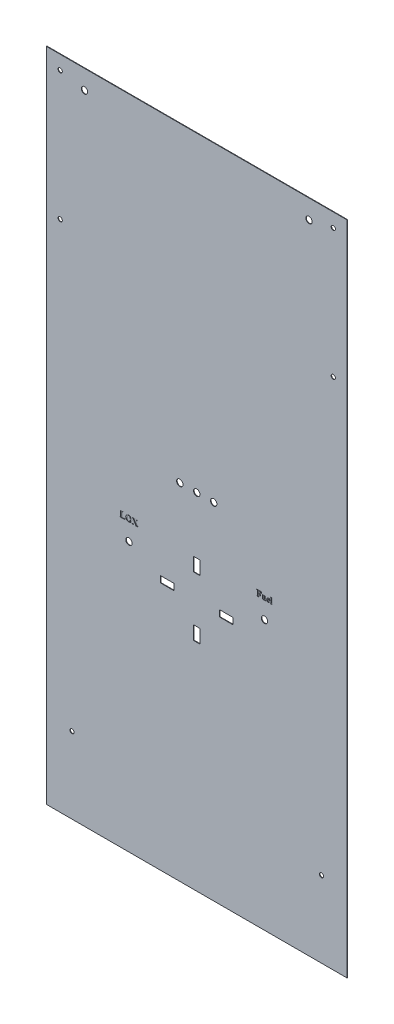
from build123d import *

# Parameters (mm, degrees)
SKETCH1_W           = 901.7
SKETCH1_H           = 1968.5
SKETCH1_R           = 6.35
BOSS_EXTRUDE1_DEPTH = 1.5875
SKETCH2_R           = 9.525
SKETCH2_W           = 19.05
SKETCH2_H           = 40.64
SKETCH2_W_2         = 40.64
SKETCH2_H_2         = 19.05
CUT_EXTRUDE1_DEPTH  = 1083.597018819
WRAP1_START         = -3.81
WRAP1_DEPTH         = 1.27
SKETCH4_R           = 9.525
CUT_EXTRUDE4_DEPTH  = 22.86
SKETCH6_R           = 9.525
CUT_EXTRUDE5_DEPTH  = 2.54


# Read off the part's stored shape, not the designer's step: Wrap1
with BuildPart() as part:
    # Sketch1 → Boss-Extrude1 (new body)
    with BuildSketch(Plane.XY):
        Rectangle(SKETCH1_W, SKETCH1_H)
        with Locations((-409.447415534, 942.65240495)):
            Circle(SKETCH1_R, mode=Mode.SUBTRACT)
        with Locations((-409.447415534, 555.94759505)):
            Circle(SKETCH1_R, mode=Mode.SUBTRACT)
        with Locations((-374.018387972, -755.65)):
            Circle(SKETCH1_R, mode=Mode.SUBTRACT)
        with Locations(Location((374.018387972, -755.65, 0), (0, 0, 180))):
            Circle(SKETCH1_R, mode=Mode.SUBTRACT)
        with Locations(Location((409.447415534, 555.94759505, 0), (0, 0, 180))):
            Circle(SKETCH1_R, mode=Mode.SUBTRACT)
        with Locations(Location((409.447415534, 942.65240495, 0), (0, 0, 180))):
            Circle(SKETCH1_R, mode=Mode.SUBTRACT)
    extrude(amount=BOSS_EXTRUDE1_DEPTH)

    # Sketch2 → Cut-Extrude1 (cut, through all)
    with BuildSketch(Plane(origin=(0, 0, 0), x_dir=(-1, 0, 0), z_dir=(0, 0, -1))):
        with Locations((203.2, -177.8)):
            Circle(SKETCH2_R)
        with Locations(Location((-203.2, -177.8, 0), (0, 0, 180))):
            Circle(SKETCH2_R)
        with Locations((0, -139.7)):
            Rectangle(SKETCH2_W, SKETCH2_H)
        with Locations((-88.9, -228.6)):
            Rectangle(SKETCH2_W_2, SKETCH2_H_2)
        with Locations((88.9, -228.6)):
            Rectangle(SKETCH2_W_2, SKETCH2_H_2)
        with Locations((0, -317.5)):
            Rectangle(SKETCH2_W, SKETCH2_H)
    extrude(amount=-CUT_EXTRUDE1_DEPTH, mode=Mode.SUBTRACT)

    # Wrap1 outline → Wrap1 (cut)
    # profile 1 of 7: a face of its own
    with BuildSketch(Plane.XY.offset(4.1275).offset(WRAP1_START)):
        with BuildLine():
            add(Edge.make_bspline(
                [(-229.753426043, -126.522165256), (-229.636237529, -126.519976219), (-229.41317649, -126.515809523), (-229.09617467, -126.466288885), (-228.813209456, -126.387863271), (-228.646163395, -126.304456099), (-228.566305351, -126.264582464)],
                knots=[0, 0, 0, 0, 0.286116983, 0.54460586, 0.782294265, 1, 1, 1, 1], degree=3))
            Line((-229.753426043, -126.522165256), (-230.317121718, -126.522165256))
            Line((-230.317121718, -126.522165256), (-230.317121718, -127))
            Line((-230.317121718, -127), (-215.265327284, -127))
            Line((-215.265327284, -127), (-214.548575168, -120.788148329))
            Line((-214.548575168, -120.788148329), (-215.026409912, -120.788148329))
            add(Edge.make_bspline(
                [(-220.151934157, -125.80541314), (-219.932562836, -125.800281899), (-219.510508502, -125.790409766), (-218.907320259, -125.698872442), (-218.358302074, -125.557162613), (-217.864370172, -125.344330626), (-217.414474169, -125.065851051), (-217.002301016, -124.717785385), (-216.620132883, -124.304052356), (-216.331879217, -123.906660058), (-216.11791995, -123.547865792), (-215.951997015, -123.245314942), (-215.794334863, -122.908249637), (-215.632393068, -122.54506771), (-215.481375396, -122.148092083), (-215.322503972, -121.724083219), (-215.171391707, -121.266497406), (-215.07550252, -120.950123175), (-215.026409912, -120.788148329)],
                knots=[0, 0, 0, 0, 0.083692486, 0.161018205, 0.232346257, 0.299586786, 0.365500353, 0.433621102, 0.504882686, 0.580041871, 0.620531465, 0.664319798, 0.71170201, 0.762539634, 0.816086004, 0.873798358, 0.935388254, 1, 1, 1, 1], degree=3))
            Line((-220.151934157, -125.80541314), (-221.585438389, -125.80541314))
            add(Edge.make_bspline(
                [(-223.119735887, -125.693420622), (-223.047852608, -125.711296101), (-222.870193417, -125.755475265), (-222.540067551, -125.779019781), (-222.101040503, -125.803347996), (-221.769696871, -125.804675129), (-221.585438389, -125.80541314)],
                knots=[0, 0, 0, 0, 0.143896066, 0.355638461, 0.641673878, 1, 1, 1, 1], degree=3))
            add(Edge.make_bspline(
                [(-223.866352675, -123.498367267), (-223.865392, -123.601652345), (-223.863551432, -123.799537588), (-223.856493191, -124.080826647), (-223.844815466, -124.333432834), (-223.832218453, -124.555332016), (-223.808811963, -124.748212218), (-223.783249281, -124.91138468), (-223.756011668, -125.047332218), (-223.70606115, -125.185917292), (-223.625445227, -125.332812904), (-223.491822327, -125.481418383), (-223.318626353, -125.601331533), (-223.187975318, -125.661824804), (-223.119735887, -125.693420622)],
                knots=[0, 0, 0, 0, 0.124219593, 0.237993955, 0.338360787, 0.42835088, 0.505199409, 0.571874059, 0.627062731, 0.671557261, 0.748594982, 0.82701569, 0.909649771, 1, 1, 1, 1], degree=3))
            Line((-223.866352675, -123.498367267), (-223.866352675, -112.664957682))
            add(Edge.make_bspline(
                [(-223.739427821, -111.119460932), (-223.749999809, -111.149146381), (-223.773852692, -111.216123714), (-223.798505966, -111.335239557), (-223.821268807, -111.483376173), (-223.833059635, -111.663254918), (-223.849289377, -111.87085995), (-223.861102616, -112.108602576), (-223.862236444, -112.376276017), (-223.864933293, -112.565412846), (-223.866352675, -112.664957682)],
                knots=[0, 0, 0, 0, 0.06067886, 0.136905735, 0.233920776, 0.349449884, 0.48411048, 0.635389887, 0.808101606, 1, 1, 1, 1], degree=3))
            add(Edge.make_bspline(
                [(-223.261593077, -110.533366754), (-223.310259198, -110.565232512), (-223.409867386, -110.630454278), (-223.538040862, -110.765996793), (-223.649286752, -110.930935983), (-223.708665918, -111.055124151), (-223.739427821, -111.119460932)],
                knots=[0, 0, 0, 0, 0.226387342, 0.463362038, 0.721989949, 1, 1, 1, 1], degree=3))
            add(Edge.make_bspline(
                [(-222.160333316, -110.275783963), (-222.268802824, -110.278119635), (-222.476986966, -110.28260246), (-222.772042924, -110.330870623), (-223.035001757, -110.410815629), (-223.188015126, -110.493572376), (-223.261593077, -110.533366754)],
                knots=[0, 0, 0, 0, 0.284002636, 0.54508263, 0.781248603, 1, 1, 1, 1], degree=3))
            Line((-222.160333316, -110.275783963), (-221.477178955, -110.275783963))
            Line((-221.477178955, -110.275783963), (-221.477178955, -109.797949219))
            Line((-221.477178955, -109.797949219), (-230.317121718, -109.797949219))
            Line((-230.317121718, -109.797949219), (-230.317121718, -110.275783963))
            Line((-230.317121718, -110.275783963), (-229.753426043, -110.275783963))
            add(Edge.make_bspline(
                [(-227.927947998, -112.664957682), (-227.929376487, -112.564168786), (-227.932110034, -112.371299754), (-227.933119221, -112.09740266), (-227.945249249, -111.853456485), (-227.960174603, -111.640682081), (-227.976466296, -111.455801376), (-228.004528872, -111.302130434), (-228.026816696, -111.175687487), (-228.073793401, -111.049072991), (-228.148610431, -110.910709437), (-228.275397871, -110.764872143), (-228.434574129, -110.630147904), (-228.626451322, -110.505917808), (-228.855303867, -110.400345023), (-229.122678716, -110.328270983), (-229.42585248, -110.282806886), (-229.64000416, -110.27821564), (-229.753426043, -110.275783963)],
                knots=[0, 0, 0, 0, 0.084622749, 0.161933587, 0.22990784, 0.289599081, 0.34105252, 0.385532842, 0.420773186, 0.448530112, 0.498553263, 0.551922288, 0.609709232, 0.67316662, 0.743282504, 0.820338844, 0.90484545, 1, 1, 1, 1], degree=3))
            Line((-227.927947998, -112.664957682), (-227.927947998, -124.132991536))
            add(Edge.make_bspline(
                [(-228.066072104, -125.678488286), (-228.053878904, -125.648919223), (-228.026103286, -125.581562086), (-228.005452117, -125.460770969), (-227.975507496, -125.313738641), (-227.960396653, -125.134824087), (-227.945152957, -124.925847451), (-227.933270797, -124.688097364), (-227.932024686, -124.420430161), (-227.929359829, -124.232536736), (-227.927947998, -124.132991536)],
                knots=[0, 0, 0, 0, 0.061394352, 0.139853863, 0.234760276, 0.350352995, 0.484827155, 0.638289672, 0.808367287, 1, 1, 1, 1], degree=3))
            add(Edge.make_bspline(
                [(-228.566305351, -126.264582464), (-228.513841635, -126.232933684), (-228.407719614, -126.168915485), (-228.271425976, -126.033307564), (-228.155927585, -125.868003182), (-228.096632758, -125.742944001), (-228.066072104, -125.678488286)],
                knots=[0, 0, 0, 0, 0.23335888, 0.472031298, 0.72788403, 1, 1, 1, 1], degree=3))
        make_face()
    # profile 2 of 7: a face of its own
    with BuildSketch(Plane.XY.offset(4.1275).offset(WRAP1_START)):
        with BuildLine():
            add(Edge.make_bspline(
                [(-194.718433295, -118.260850504), (-194.724017479, -118.527395433), (-194.735035576, -119.053312496), (-194.827203283, -119.829949656), (-194.977372559, -120.582130209), (-195.180608052, -121.312966858), (-195.451068619, -122.017123582), (-195.783231756, -122.69419378), (-196.164460973, -123.35329381), (-196.468850095, -123.762458061), (-196.622306103, -123.968735843)],
                knots=[0, 0, 0, 0, 0.130405832, 0.257302407, 0.382101033, 0.505478704, 0.628069418, 0.750625341, 0.874279213, 1, 1, 1, 1], degree=3))
            add(Edge.make_bspline(
                [(-203.909285948, -109.559031847), (-203.576856146, -109.553848597), (-202.926775912, -109.543712539), (-201.973128758, -109.637324107), (-201.066575694, -109.807149904), (-200.206609472, -110.059482945), (-199.398043873, -110.403407626), (-198.634697098, -110.827047087), (-197.919622082, -111.336565182), (-197.261501448, -111.926383685), (-196.66864867, -112.576115942), (-196.145231314, -113.269846968), (-195.70250353, -114.003776103), (-195.342394477, -114.778877827), (-195.06002235, -115.592766401), (-194.864971074, -116.447883307), (-194.741519452, -117.341405333), (-194.726223502, -117.950592369), (-194.718433295, -118.260850504)],
                knots=[0, 0, 0, 0, 0.069849949, 0.136594465, 0.20103729, 0.263531056, 0.324607527, 0.385387455, 0.446727247, 0.508796852, 0.570828957, 0.631365177, 0.691215795, 0.75067175, 0.810735822, 0.87197288, 0.934795961, 1, 1, 1, 1], degree=3))
            add(Edge.make_bspline(
                [(-212.876153564, -118.272049756), (-212.868157043, -117.961837627), (-212.852455997, -117.352740923), (-212.731856278, -116.457996138), (-212.525783502, -115.604326355), (-212.240446011, -114.788989394), (-211.87789791, -114.011937584), (-211.430577993, -113.276279528), (-210.899609784, -112.582201243), (-210.294740021, -111.934406847), (-209.633428736, -111.3455359), (-208.927659924, -110.831424373), (-208.1808215, -110.409611212), (-207.398487794, -110.06609697), (-206.578639267, -109.807869114), (-205.720070019, -109.63766039), (-204.82597401, -109.543972597), (-204.218086037, -109.553958913), (-203.909285948, -109.559031847)],
                knots=[0, 0, 0, 0, 0.066265956, 0.130112177, 0.192469093, 0.253598737, 0.314376421, 0.375339326, 0.437182314, 0.500765603, 0.564420002, 0.626110784, 0.686953563, 0.747315202, 0.808362113, 0.870201672, 0.934063944, 1, 1, 1, 1], degree=3))
            add(Edge.make_bspline(
                [(-210.882686742, -124.121792285), (-211.041964948, -123.914138898), (-211.358752432, -123.501138302), (-211.765029578, -122.838579483), (-212.106515122, -122.146758921), (-212.387202635, -121.427235156), (-212.608287484, -120.679395853), (-212.764464604, -119.902462731), (-212.860479239, -119.097003096), (-212.870876009, -118.549812049), (-212.876153564, -118.272049756)],
                knots=[0, 0, 0, 0, 0.124469297, 0.247556251, 0.369105337, 0.491161059, 0.614633392, 0.73970266, 0.867869208, 1, 1, 1, 1], degree=3))
            add(Edge.make_bspline(
                [(-203.745030255, -127.238917372), (-203.934245051, -127.237184516), (-204.308079424, -127.233760888), (-204.860990224, -127.193963899), (-205.39821356, -127.136256498), (-205.919316031, -127.05062999), (-206.422649041, -126.9359105), (-206.913431242, -126.809580948), (-207.38332404, -126.64672569), (-207.83756508, -126.462373568), (-208.278052534, -126.25912154), (-208.700899992, -126.027151484), (-209.104515854, -125.767855886), (-209.493225434, -125.487366165), (-209.868142157, -125.18574585), (-210.223166586, -124.854873643), (-210.563395068, -124.500787124), (-210.775787893, -124.248679752), (-210.882686742, -124.121792285)],
                knots=[0, 0, 0, 0, 0.070311969, 0.138916362, 0.205924571, 0.271084613, 0.335043637, 0.397754782, 0.459328336, 0.519703925, 0.579914551, 0.639525377, 0.698797951, 0.758099388, 0.817616847, 0.877506899, 0.938348334, 1, 1, 1, 1], degree=3))
            add(Edge.make_bspline(
                [(-196.622306103, -123.968735843), (-196.728949032, -124.102023109), (-196.940164733, -124.366010264), (-197.283101614, -124.734937967), (-197.635197756, -125.084869872), (-198.011845907, -125.40091671), (-198.399119001, -125.697042327), (-198.803860249, -125.967274303), (-199.225970337, -126.209236136), (-199.663398873, -126.426575744), (-200.117876159, -126.616624885), (-200.586542788, -126.786275217), (-201.075280584, -126.922569372), (-201.578199328, -127.039072591), (-202.097972362, -127.128677976), (-202.632721999, -127.190039728), (-203.183066067, -127.234871185), (-203.555792531, -127.237554845), (-203.745030255, -127.238917372)],
                knots=[0, 0, 0, 0, 0.062892078, 0.124563294, 0.185534769, 0.245726785, 0.305624548, 0.365154215, 0.424941259, 0.484831998, 0.54505371, 0.606415486, 0.668404777, 0.731930775, 0.796623147, 0.862668568, 0.930275174, 1, 1, 1, 1], degree=3))
        make_face()
        with BuildLine():
            add(Edge.make_bspline(
                [(-207.336257002, -112.877743467), (-207.418011601, -113.046803464), (-207.587222221, -113.396713404), (-207.782425416, -113.966883133), (-207.955597854, -114.586083402), (-208.096394776, -115.258230894), (-208.202657758, -115.983986359), (-208.279731821, -116.761310103), (-208.329848235, -117.590726366), (-208.334386685, -118.161225378), (-208.336723497, -118.454970868)],
                knots=[0, 0, 0, 0, 0.098492955, 0.203854633, 0.315738249, 0.435901004, 0.564024753, 0.700575662, 0.845828744, 1, 1, 1, 1], degree=3))
            add(Edge.make_bspline(
                [(-203.759962591, -110.514701335), (-203.950981852, -110.521329236), (-204.32403358, -110.534273219), (-204.864161608, -110.651635695), (-205.370511851, -110.832833113), (-205.839443614, -111.097103002), (-206.275888465, -111.429981496), (-206.669491416, -111.845337128), (-207.030434857, -112.329324537), (-207.232117168, -112.690993562), (-207.336257002, -112.877743467)],
                knots=[0, 0, 0, 0, 0.126292685, 0.246643735, 0.364165419, 0.481050344, 0.601480292, 0.726142767, 0.858592225, 1, 1, 1, 1], degree=3))
            add(Edge.make_bspline(
                [(-199.257863363, -118.555764135), (-199.260150236, -118.28570862), (-199.264577899, -117.762848584), (-199.294598316, -117.004720651), (-199.342354753, -116.298778745), (-199.408046938, -115.644744856), (-199.495249504, -115.0437181), (-199.610124055, -114.49664799), (-199.731670696, -113.999601347), (-199.883973099, -113.55448585), (-200.051568333, -113.153189474), (-200.220491672, -112.780337458), (-200.40937288, -112.442418253), (-200.600277353, -112.129008589), (-200.81201909, -111.85395378), (-201.027892107, -111.603286144), (-201.259982249, -111.387840569), (-201.578216058, -111.139023945), (-202.003960149, -110.884710985), (-202.557457648, -110.672459309), (-203.145997012, -110.53477257), (-203.552612772, -110.521479837), (-203.759962591, -110.514701335)],
                knots=[0, 0, 0, 0, 0.078235768, 0.15147388, 0.219769184, 0.283189358, 0.341871029, 0.39560353, 0.44509179, 0.490008293, 0.531715711, 0.571069594, 0.608500784, 0.643809453, 0.677264075, 0.708938794, 0.739545141, 0.768823346, 0.825888193, 0.882390021, 0.940025916, 1, 1, 1, 1], degree=3))
            add(Edge.make_bspline(
                [(-201.609706243, -125.659822867), (-201.518910442, -125.590370406), (-201.334389107, -125.449224443), (-201.075831196, -125.206206225), (-200.838968032, -124.92773117), (-200.61305054, -124.624253287), (-200.404645933, -124.290370142), (-200.209378265, -123.928329827), (-200.036400501, -123.533280409), (-199.869397069, -123.111498101), (-199.726283579, -122.655643678), (-199.596770806, -122.168011215), (-199.496883696, -121.645799464), (-199.404119426, -121.092516696), (-199.339843069, -120.505377496), (-199.289895411, -119.885502452), (-199.266084208, -119.231633965), (-199.260648465, -118.784738968), (-199.257863363, -118.555764135)],
                knots=[0, 0, 0, 0, 0.044242423, 0.089912429, 0.137048047, 0.185612229, 0.236272384, 0.289296534, 0.344719967, 0.403142498, 0.464849718, 0.529587621, 0.598372434, 0.670607157, 0.746741958, 0.826962138, 0.911340884, 1, 1, 1, 1], degree=3))
            add(Edge.make_bspline(
                [(-203.786094178, -126.283247884), (-203.577534203, -126.277488771), (-203.174112894, -126.266348815), (-202.597987697, -126.140658338), (-202.068139274, -125.953526382), (-201.760935203, -125.756710469), (-201.609706243, -125.659822867)],
                knots=[0, 0, 0, 0, 0.271629072, 0.525416998, 0.766374536, 1, 1, 1, 1], degree=3))
            add(Edge.make_bspline(
                [(-206.794959831, -124.838544401), (-206.703104717, -124.954220234), (-206.52357018, -125.180313328), (-206.21090486, -125.474389772), (-205.875288692, -125.728431585), (-205.505384156, -125.927398468), (-205.115500528, -126.09224697), (-204.695677531, -126.202467996), (-204.250044979, -126.271235548), (-203.943147012, -126.279181566), (-203.786094178, -126.283247884)],
                knots=[0, 0, 0, 0, 0.12750736, 0.249218294, 0.369884192, 0.490218952, 0.611248533, 0.734906211, 0.864340154, 1, 1, 1, 1], degree=3))
            add(Edge.make_bspline(
                [(-208.336723497, -118.454970868), (-208.333476883, -118.803555521), (-208.327195784, -119.477948657), (-208.249358748, -120.453508534), (-208.133703357, -121.359168115), (-207.967016958, -122.194241479), (-207.751395889, -122.960169556), (-207.48801407, -123.655909283), (-207.176706047, -124.284764584), (-206.920066783, -124.657058109), (-206.794959831, -124.838544401)],
                knots=[0, 0, 0, 0, 0.156670188, 0.303103704, 0.439658844, 0.566921389, 0.685563365, 0.796936138, 0.901010077, 1, 1, 1, 1], degree=3))
        make_face(mode=Mode.SUBTRACT)
    # profile 3 of 7: a face of its own
    with BuildSketch(Plane.XY.offset(4.1275).offset(WRAP1_START)):
        with BuildLine():
            add(Edge.make_bspline(
                [(-178.315262477, -123.901540332), (-178.220954099, -124.042332192), (-178.040973638, -124.311022891), (-177.780417607, -124.691101697), (-177.542567801, -125.028886613), (-177.321117656, -125.319631326), (-177.124841845, -125.569878388), (-176.950043375, -125.777286062), (-176.794414717, -125.938631232), (-176.614360473, -126.095060742), (-176.388000485, -126.240639613), (-176.102705495, -126.377493649), (-175.792360898, -126.470692124), (-175.576923504, -126.504766569), (-175.466919433, -126.522165256)],
                knots=[0, 0, 0, 0, 0.126497608, 0.241411193, 0.343994715, 0.434841881, 0.514196246, 0.581398797, 0.637233328, 0.681363404, 0.759169511, 0.837285515, 0.916916671, 1, 1, 1, 1], degree=3))
            Line((-178.315262477, -123.901540332), (-182.847226376, -117.058797476))
            Line((-182.847226376, -117.058797476), (-179.67410503, -113.116660839))
            add(Edge.make_bspline(
                [(-178.035281181, -111.138126352), (-178.067911162, -111.171467294), (-178.144929118, -111.250163361), (-178.270668934, -111.394301992), (-178.43270684, -111.576080202), (-178.621005906, -111.804397521), (-178.841537657, -112.072940804), (-179.091408658, -112.383005643), (-179.372355461, -112.735384894), (-179.569662217, -112.984692027), (-179.67410503, -113.116660839)],
                knots=[0, 0, 0, 0, 0.054447391, 0.128514533, 0.223210912, 0.338706703, 0.473921181, 0.62886415, 0.803542095, 1, 1, 1, 1], degree=3))
            add(Edge.make_bspline(
                [(-175.870092498, -110.275783963), (-175.988388839, -110.28054247), (-176.213111938, -110.289582027), (-176.53193173, -110.325021943), (-176.814061909, -110.385280788), (-177.069543497, -110.463935091), (-177.309766105, -110.576399345), (-177.5452197, -110.730779986), (-177.792284414, -110.916455595), (-177.951864525, -111.062030552), (-178.035281181, -111.138126352)],
                knots=[0, 0, 0, 0, 0.147897503, 0.280955311, 0.400178886, 0.507855505, 0.614267687, 0.73028563, 0.859013314, 1, 1, 1, 1], degree=3))
            Line((-175.870092498, -110.275783963), (-175.870092498, -109.797949219))
            Line((-175.870092498, -109.797949219), (-182.283530702, -109.797949219))
            Line((-182.283530702, -109.797949219), (-182.283530702, -110.275783963))
            add(Edge.make_bspline(
                [(-180.394590229, -111.526367082), (-180.403774393, -111.415123672), (-180.422240277, -111.191455202), (-180.57988662, -110.882221614), (-180.818105816, -110.61362874), (-181.096798512, -110.451322452), (-181.369936212, -110.360529529), (-181.630665232, -110.309534589), (-181.94074642, -110.282292916), (-182.16401731, -110.278053341), (-182.283530702, -110.275783963)],
                knots=[0, 0, 0, 0, 0.130173209, 0.261729146, 0.399541564, 0.547861549, 0.634397953, 0.737427191, 0.859448911, 1, 1, 1, 1], degree=3))
            add(Edge.make_bspline(
                [(-181.77956437, -113.919273885), (-181.670165064, -113.783270081), (-181.462006767, -113.524490375), (-181.183403562, -113.142693233), (-180.942598204, -112.797280643), (-180.746913136, -112.482078866), (-180.592210352, -112.200149806), (-180.481139557, -111.948754979), (-180.412179484, -111.727798585), (-180.400053988, -111.588937844), (-180.394590229, -111.526367082)],
                knots=[0, 0, 0, 0, 0.187080214, 0.355964768, 0.50655841, 0.638342089, 0.753533152, 0.850920003, 0.932824433, 1, 1, 1, 1], degree=3))
            Line((-181.77956437, -113.919273885), (-183.504249149, -116.062064065))
            Line((-183.504249149, -116.062064065), (-185.609708489, -112.885209635))
            Line((-185.609708489, -112.885209635), (-186.479517047, -111.574897173))
            add(Edge.make_bspline(
                [(-186.565377977, -111.093329345), (-186.562378123, -111.181261317), (-186.556756568, -111.34604082), (-186.504082454, -111.502111254), (-186.479517047, -111.574897173)],
                knots=[0, 0, 0, 0, 0.533634166, 1, 1, 1, 1], degree=3))
            add(Edge.make_bspline(
                [(-185.258798599, -110.275783963), (-185.37104042, -110.27798624), (-185.579143812, -110.282069401), (-185.863294114, -110.327280866), (-186.098857514, -110.391690812), (-186.275812465, -110.500759486), (-186.407129066, -110.626867808), (-186.500166643, -110.768269442), (-186.554446759, -110.926544536), (-186.561681095, -111.036923576), (-186.565377977, -111.093329345)],
                knots=[0, 0, 0, 0, 0.193798871, 0.359315288, 0.49675642, 0.612601935, 0.714528736, 0.809401167, 0.902600404, 1, 1, 1, 1], degree=3))
            Line((-185.258798599, -110.275783963), (-184.829493946, -110.275783963))
            Line((-184.829493946, -110.275783963), (-184.829493946, -109.797949219))
            Line((-184.829493946, -109.797949219), (-193.221466637, -109.797949219))
            Line((-193.221466637, -109.797949219), (-193.221466637, -110.275783963))
            add(Edge.make_bspline(
                [(-191.646105215, -111.134393268), (-191.700723502, -111.068399346), (-191.804776639, -110.94267452), (-191.976203892, -110.781825301), (-192.140999932, -110.645457869), (-192.314779915, -110.541253063), (-192.499368964, -110.450303007), (-192.714520602, -110.384128408), (-192.956368151, -110.317695745), (-193.130245394, -110.290205942), (-193.221466637, -110.275783963)],
                knots=[0, 0, 0, 0, 0.138951375, 0.264715855, 0.381158651, 0.485468856, 0.593016643, 0.714420306, 0.850176286, 1, 1, 1, 1], degree=3))
            add(Edge.make_bspline(
                [(-190.425386768, -112.892675802), (-190.510008736, -112.76824351), (-190.66916105, -112.53421814), (-190.893644324, -112.203950584), (-191.090125143, -111.919755069), (-191.2558718, -111.677666631), (-191.393563225, -111.479483765), (-191.504256651, -111.326045529), (-191.583346182, -111.213936229), (-191.628526414, -111.156673246), (-191.646105215, -111.134393268)],
                knots=[0, 0, 0, 0, 0.210884309, 0.396619539, 0.559630646, 0.695069056, 0.807787606, 0.897795021, 0.960233914, 1, 1, 1, 1], degree=3))
            Line((-190.425386768, -112.892675802), (-186.15100566, -119.347177929))
            Line((-186.15100566, -119.347177929), (-189.484649616, -123.487168015))
            add(Edge.make_bspline(
                [(-191.84022558, -125.913672574), (-191.766050175, -125.859885825), (-191.606062475, -125.743874079), (-191.366058271, -125.535878004), (-191.099990605, -125.294138782), (-190.816694507, -125.0094193), (-190.515967961, -124.681894349), (-190.185947113, -124.322032296), (-189.840526286, -123.918365216), (-189.606143705, -123.634376066), (-189.484649616, -123.487168015)],
                knots=[0, 0, 0, 0, 0.081036263, 0.17478577, 0.280771193, 0.39911038, 0.529989712, 0.674191297, 0.831114449, 1, 1, 1, 1], degree=3))
            add(Edge.make_bspline(
                [(-193.605974282, -126.522165256), (-193.428475542, -126.492064393), (-193.090058547, -126.434674445), (-192.617066321, -126.297633403), (-192.196800775, -126.137494655), (-191.955258099, -125.985878432), (-191.84022558, -125.913672574)],
                knots=[0, 0, 0, 0, 0.286640828, 0.546506005, 0.784027577, 1, 1, 1, 1], degree=3))
            Line((-193.605974282, -126.522165256), (-193.605974282, -127))
            Line((-193.605974282, -127), (-186.901355531, -127))
            Line((-186.901355531, -127), (-186.901355531, -126.522165256))
            add(Edge.make_bspline(
                [(-187.983949873, -126.451236661), (-187.92808433, -126.462106428), (-187.794865981, -126.488026741), (-187.557390939, -126.506108324), (-187.252494845, -126.5219491), (-187.025831792, -126.52208863), (-186.901355531, -126.522165256)],
                knots=[0, 0, 0, 0, 0.157013586, 0.374418457, 0.65645018, 1, 1, 1, 1], degree=3))
            add(Edge.make_bspline(
                [(-189.182269817, -125.357443068), (-189.178851806, -125.416422899), (-189.172072093, -125.53341092), (-189.110462365, -125.705148863), (-189.013051414, -125.867543086), (-188.879299513, -126.022595825), (-188.710655866, -126.166853091), (-188.499640293, -126.282553785), (-188.255487944, -126.382385117), (-188.078006956, -126.427387426), (-187.983949873, -126.451236661)],
                knots=[0, 0, 0, 0, 0.100751351, 0.199842915, 0.30878505, 0.423694858, 0.549243335, 0.686728538, 0.833979966, 1, 1, 1, 1], degree=3))
            add(Edge.make_bspline(
                [(-188.010081461, -123.468502596), (-188.103204143, -123.578415982), (-188.279522639, -123.786526001), (-188.514294387, -124.09516081), (-188.716886225, -124.372651741), (-188.880348063, -124.624214005), (-189.016057474, -124.842408939), (-189.104691846, -125.038941749), (-189.167747871, -125.205610863), (-189.177829475, -125.311017685), (-189.182269817, -125.357443068)],
                knots=[0, 0, 0, 0, 0.192150646, 0.363818055, 0.517241748, 0.650310056, 0.764194402, 0.859271298, 0.938017447, 1, 1, 1, 1], degree=3))
            Line((-188.010081461, -123.468502596), (-185.493982887, -120.340178257))
            Line((-185.493982887, -120.340178257), (-183.175737762, -123.841810989))
            add(Edge.make_bspline(
                [(-182.294729953, -125.256649801), (-182.333521799, -125.178930532), (-182.426187099, -124.993276065), (-182.619758612, -124.684435407), (-182.871831428, -124.288855042), (-183.067842083, -124.000524766), (-183.175737762, -123.841810989)],
                knots=[0, 0, 0, 0, 0.156153027, 0.373015693, 0.654871322, 1, 1, 1, 1], degree=3))
            add(Edge.make_bspline(
                [(-182.208869023, -125.663555951), (-182.212308373, -125.590514532), (-182.218918647, -125.450132254), (-182.270153016, -125.319374036), (-182.294729953, -125.256649801)],
                knots=[0, 0, 0, 0, 0.520303695, 1, 1, 1, 1], degree=3))
            add(Edge.make_bspline(
                [(-183.78049736, -126.522165256), (-183.62973452, -126.507746945), (-183.3557518, -126.481544413), (-182.988379234, -126.422634598), (-182.706918014, -126.34236816), (-182.505315768, -126.234799413), (-182.371657244, -126.106352373), (-182.274562777, -125.9723012), (-182.220308703, -125.820433904), (-182.212708266, -125.716205383), (-182.208869023, -125.663555951)],
                knots=[0, 0, 0, 0, 0.22952437, 0.417116787, 0.563269803, 0.671351673, 0.759411843, 0.842075566, 0.920226904, 1, 1, 1, 1], degree=3))
            Line((-183.78049736, -126.522165256), (-183.78049736, -127))
            Line((-183.78049736, -127), (-175.466919433, -127))
            Line((-175.466919433, -127), (-175.466919433, -126.522165256))
        make_face()
    # profile 4 of 7: a face of its own
    with BuildSketch(Plane.XY.offset(4.1275).offset(WRAP1_START)):
        with BuildLine():
            add(Edge.make_bspline(
                [(225.897150336, -124.371908908), (225.89779293, -124.478935376), (225.899018732, -124.683097566), (225.910148184, -124.974412762), (225.928150444, -125.235967251), (225.953767852, -125.466429096), (225.985672624, -125.667875825), (226.030754716, -125.836986712), (226.077542972, -125.978284731), (226.152056385, -126.125592134), (226.286821706, -126.274708238), (226.505716323, -126.402368284), (226.780484112, -126.485826486), (226.982878765, -126.509456044), (227.091737196, -126.522165256)],
                knots=[0, 0, 0, 0, 0.113303814, 0.216136768, 0.308589519, 0.390787078, 0.461608663, 0.524237009, 0.575901825, 0.618914388, 0.6982322, 0.78453931, 0.884113971, 1, 1, 1, 1], degree=3))
            Line((225.897150336, -124.371908908), (225.897150336, -109.797949219))
            Line((225.897150336, -109.797949219), (221.118802897, -109.797949219))
            Line((221.118802897, -109.797949219), (221.118802897, -110.275783963))
            add(Edge.make_bspline(
                [(222.313389757, -112.42604031), (222.312711865, -112.319019474), (222.311418729, -112.114868025), (222.300788763, -111.824721152), (222.281474139, -111.564634085), (222.258992353, -111.33456812), (222.218104833, -111.135078672), (222.18235245, -110.963141627), (222.128237881, -110.824214327), (222.055408195, -110.675778042), (221.91875454, -110.527441679), (221.703421231, -110.395520993), (221.428802406, -110.3118181), (221.227634815, -110.288434512), (221.118802897, -110.275783963)],
                knots=[0, 0, 0, 0, 0.113475465, 0.216464207, 0.307741029, 0.390063115, 0.461224767, 0.523628009, 0.575823302, 0.618901027, 0.698339003, 0.785468901, 0.883938407, 1, 1, 1, 1], degree=3))
            Line((222.313389757, -112.42604031), (222.313389757, -124.371908908))
            add(Edge.make_bspline(
                [(222.100603973, -126.03313126), (222.117659052, -126.002426672), (222.156537167, -125.93243365), (222.199031444, -125.803696314), (222.235040733, -125.643622125), (222.264353755, -125.451474495), (222.286208578, -125.227171483), (222.299234716, -124.970542076), (222.311920293, -124.681873132), (222.31288234, -124.478941952), (222.313389757, -124.371908908)],
                knots=[0, 0, 0, 0, 0.062274042, 0.141957556, 0.239524505, 0.353613935, 0.486876676, 0.639624286, 0.809925169, 1, 1, 1, 1], degree=3))
            add(Edge.make_bspline(
                [(221.118802897, -126.522165256), (221.222937791, -126.512967248), (221.420694176, -126.495499859), (221.694726847, -126.399501839), (221.929352913, -126.247804202), (222.043116973, -126.105194483), (222.100603973, -126.03313126)],
                knots=[0, 0, 0, 0, 0.274716901, 0.521698533, 0.75830578, 1, 1, 1, 1], degree=3))
            Line((221.118802897, -126.522165256), (221.118802897, -127))
            Line((221.118802897, -127), (227.091737196, -127))
            Line((227.091737196, -127), (227.091737196, -126.522165256))
        make_face()
    # profile 5 of 7: a face of its own
    with BuildSketch(Plane.XY.offset(4.1275).offset(WRAP1_START)):
        with BuildLine():
            add(Edge.make_bspline(
                [(213.473446994, -120.788148329), (213.484435832, -120.960148917), (213.505943609, -121.29679511), (213.583114555, -121.786676721), (213.684978238, -122.249040656), (213.821703415, -122.682893581), (213.983799397, -123.090003948), (214.180318154, -123.468878969), (214.401634918, -123.824018593), (214.579570657, -124.035377647), (214.668033854, -124.140457704)],
                knots=[0, 0, 0, 0, 0.142498601, 0.278903765, 0.409754711, 0.533792625, 0.654786412, 0.771718901, 0.886506916, 1, 1, 1, 1], degree=3))
            Line((213.473446994, -120.788148329), (219.685298665, -120.788148329))
            add(Edge.make_bspline(
                [(215.186932521, -115.054131402), (215.332744169, -115.058510463), (215.622200037, -115.067203493), (216.048806762, -115.134412784), (216.458018259, -115.253112742), (216.855015559, -115.409736193), (217.234216931, -115.616447449), (217.601105015, -115.865873655), (217.951321342, -116.161091595), (218.283547274, -116.50245011), (218.594544826, -116.883472124), (218.86336233, -117.315423435), (219.099552053, -117.785633618), (219.293677172, -118.302842174), (219.448696858, -118.86284987), (219.567373822, -119.466872314), (219.649949143, -120.112981811), (219.673298611, -120.558950461), (219.685298665, -120.788148329)],
                knots=[0, 0, 0, 0, 0.053851778, 0.106903072, 0.158993774, 0.210976872, 0.264244788, 0.318174982, 0.374616845, 0.433126587, 0.493931417, 0.555909881, 0.620664302, 0.688022464, 0.759624451, 0.835078572, 0.915241487, 1, 1, 1, 1], degree=3))
            add(Edge.make_bspline(
                [(209.889686415, -121.336911668), (209.894719185, -121.10276357), (209.90454369, -120.645681529), (209.980594115, -119.978999285), (210.102613191, -119.349353239), (210.2741664, -118.754968824), (210.497535894, -118.198065108), (210.772958134, -117.678469985), (211.094379424, -117.194692575), (211.463511022, -116.751469289), (211.868601015, -116.356868909), (212.289861517, -116.006538666), (212.730381362, -115.712693562), (213.188089446, -115.471799928), (213.664038535, -115.28490749), (214.156563033, -115.148604378), (214.666675717, -115.069113443), (215.012450108, -115.059156041), (215.186932521, -115.054131402)],
                knots=[0, 0, 0, 0, 0.076562623, 0.149458401, 0.21913521, 0.286105541, 0.351475226, 0.415010164, 0.478105644, 0.541102612, 0.603263254, 0.662822278, 0.720048412, 0.77611527, 0.831661283, 0.886950275, 0.942953587, 1, 1, 1, 1], degree=3))
            add(Edge.make_bspline(
                [(210.968547673, -125.271582137), (210.88102663, -125.137625359), (210.705153318, -124.868439554), (210.492613936, -124.431055744), (210.303414385, -123.974618269), (210.150153402, -123.492736846), (210.037104595, -122.986250765), (209.948583271, -122.458223958), (209.902174638, -121.905168811), (209.893899387, -121.528616399), (209.889686415, -121.336911668)],
                knots=[0, 0, 0, 0, 0.115803047, 0.23270593, 0.351552617, 0.473563527, 0.598418097, 0.72719374, 0.861112958, 1, 1, 1, 1], degree=3))
            add(Edge.make_bspline(
                [(214.914417394, -127.238917372), (214.703729756, -127.233864665), (214.292610381, -127.224005208), (213.696785522, -127.127513253), (213.13887858, -126.977069211), (212.622985722, -126.757196627), (212.145015008, -126.480466919), (211.707965539, -126.139364108), (211.30691038, -125.738898373), (211.082697561, -125.429235729), (210.968547673, -125.271582137)],
                knots=[0, 0, 0, 0, 0.137204424, 0.267729979, 0.392271254, 0.512917972, 0.632116942, 0.751180664, 0.873322589, 1, 1, 1, 1], degree=3))
            add(Edge.make_bspline(
                [(219.685298665, -123.416239421), (219.605780294, -123.584895446), (219.451712401, -123.911668717), (219.204794229, -124.376907407), (218.950341491, -124.801946302), (218.694303997, -125.193874332), (218.424581023, -125.543359165), (218.15255458, -125.859695507), (217.873300421, -126.136028928), (217.586567255, -126.375587228), (217.288999838, -126.576118976), (216.984868778, -126.755089568), (216.667742744, -126.902249872), (216.340858213, -127.028855322), (216.000030954, -127.120331824), (215.648204292, -127.18765311), (215.285001608, -127.229779755), (215.038965215, -127.235846355), (214.914417394, -127.238917372)],
                knots=[0, 0, 0, 0, 0.085828138, 0.166293149, 0.242330062, 0.313823047, 0.381648941, 0.445397375, 0.505750891, 0.562298265, 0.617113102, 0.670757122, 0.724569091, 0.777869471, 0.831927831, 0.886751647, 0.942671751, 1, 1, 1, 1], degree=3))
            Line((219.685298665, -123.416239421), (219.255994013, -123.177322049))
            add(Edge.make_bspline(
                [(216.672699928, -125.088661024), (216.791421251, -125.083974405), (217.025324331, -125.074740892), (217.365670203, -124.991010226), (217.691516567, -124.865737813), (218.002764023, -124.673953047), (218.310747805, -124.415701638), (218.624350768, -124.079404838), (218.942669548, -123.658350097), (219.14729079, -123.344207513), (219.255994013, -123.177322049)],
                knots=[0, 0, 0, 0, 0.105424729, 0.207706318, 0.31005375, 0.414825833, 0.531164543, 0.666607217, 0.822888038, 1, 1, 1, 1], degree=3))
            add(Edge.make_bspline(
                [(214.668033854, -124.140457704), (214.737224099, -124.216910611), (214.87225015, -124.36610988), (215.100832508, -124.556095409), (215.334102487, -124.723587943), (215.583593361, -124.852302243), (215.839535799, -124.960699447), (216.10831747, -125.033406274), (216.387327271, -125.080545548), (216.576688627, -125.085930639), (216.672699928, -125.088661024)],
                knots=[0, 0, 0, 0, 0.134919963, 0.263298817, 0.388576173, 0.510368139, 0.630257589, 0.752082285, 0.87429905, 1, 1, 1, 1], degree=3))
        make_face()
        with BuildLine():
            add(Edge.make_bspline(
                [(215.758094364, -116.21885359), (215.715890545, -116.185464945), (215.631040376, -116.118337554), (215.474479544, -116.057257161), (215.302645961, -116.013317442), (215.179795928, -116.011002805), (215.116003927, -116.00980089)],
                knots=[0, 0, 0, 0, 0.232672174, 0.467784049, 0.723637675, 1, 1, 1, 1], degree=3))
            add(Edge.make_bspline(
                [(216.57937283, -119.832478841), (216.57815544, -119.683164175), (216.575821963, -119.396959862), (216.572034655, -118.984794933), (216.54875463, -118.609325407), (216.535561247, -118.270170354), (216.502716886, -117.96930557), (216.470920622, -117.703778395), (216.432081819, -117.47387069), (216.367082665, -117.223662081), (216.275295191, -116.951215735), (216.135391836, -116.663950962), (215.965533996, -116.416189083), (215.826465873, -116.283894804), (215.758094364, -116.21885359)],
                knots=[0, 0, 0, 0, 0.117461895, 0.225149355, 0.32413075, 0.413337278, 0.492033041, 0.562085029, 0.623719301, 0.675235114, 0.765312701, 0.849359813, 0.925939196, 1, 1, 1, 1], degree=3))
            Line((216.57937283, -119.832478841), (213.473446994, -119.832478841))
            Line((213.473446994, -119.832478841), (213.473446994, -119.425572692))
            add(Edge.make_bspline(
                [(214.145402103, -116.599628152), (214.091434461, -116.688287968), (213.980986667, -116.869735237), (213.844736112, -117.165381535), (213.728537195, -117.483751515), (213.636225129, -117.826357975), (213.561311693, -118.19146538), (213.509581338, -118.581886146), (213.480528455, -118.995820581), (213.475846785, -119.279936775), (213.473446994, -119.425572692)],
                knots=[0, 0, 0, 0, 0.105683126, 0.216286423, 0.330999153, 0.450650361, 0.577463014, 0.710511166, 0.851610106, 1, 1, 1, 1], degree=3))
            add(Edge.make_bspline(
                [(215.116003927, -116.00980089), (215.020260492, -116.016772573), (214.83218273, -116.030467701), (214.565365604, -116.148259392), (214.329499766, -116.339846718), (214.208686654, -116.510326903), (214.145402103, -116.599628152)],
                knots=[0, 0, 0, 0, 0.241168632, 0.473750048, 0.724338765, 1, 1, 1, 1], degree=3))
        make_face(mode=Mode.SUBTRACT)
    # profile 6 of 7: a face of its own
    with BuildSketch(Plane.XY.offset(4.1275).offset(WRAP1_START)):
        with BuildLine():
            add(Edge.make_bspline(
                [(206.783760579, -124.371908908), (206.784395331, -124.481422313), (206.785600291, -124.689313397), (206.796716774, -124.98562686), (206.814858649, -125.249598645), (206.839487333, -125.481578661), (206.874699328, -125.680382411), (206.908140845, -125.849243391), (206.956107465, -125.984974566), (207.031210314, -126.124276012), (207.170474694, -126.25992339), (207.387587762, -126.383262682), (207.662881164, -126.474804773), (207.868148551, -126.505621261), (207.978347439, -126.522165256)],
                knots=[0, 0, 0, 0, 0.116020453, 0.220243522, 0.314076703, 0.396332412, 0.467204098, 0.527976068, 0.578435535, 0.619154622, 0.694668533, 0.780359926, 0.882085058, 1, 1, 1, 1], degree=3))
            Line((206.783760579, -124.371908908), (206.783760579, -115.293048774))
            Line((206.783760579, -115.293048774), (202.00541314, -115.293048774))
            Line((202.00541314, -115.293048774), (202.00541314, -115.770883518))
            add(Edge.make_bspline(
                [(203.2, -117.921139865), (203.199305079, -117.81163153), (203.197985899, -117.603750069), (203.187677488, -117.308613101), (203.167253485, -117.046210669), (203.148921221, -116.816286749), (203.113921953, -116.618234257), (203.074152161, -116.453668371), (203.031530681, -116.31754321), (202.956042568, -116.181060606), (202.820065788, -116.043443893), (202.60464931, -115.916301083), (202.325177344, -115.826497773), (202.117978104, -115.790461121), (202.00541314, -115.770883518)],
                knots=[0, 0, 0, 0, 0.116169972, 0.220527356, 0.313164742, 0.395388824, 0.465050798, 0.526201019, 0.575042058, 0.615813621, 0.690509018, 0.77698849, 0.878844718, 1, 1, 1, 1], degree=3))
            Line((203.2, -117.921139865), (203.2, -124.237517887))
            add(Edge.make_bspline(
                [(202.091274071, -125.566495768), (202.174168154, -125.500185334), (202.359746653, -125.351733352), (202.618448108, -125.051194896), (202.912171947, -124.679578898), (203.099173586, -124.392372239), (203.2, -124.237517887)],
                knots=[0, 0, 0, 0, 0.182785657, 0.409210003, 0.681461416, 1, 1, 1, 1], degree=3))
            add(Edge.make_bspline(
                [(201.337191115, -125.80541314), (201.405906056, -125.802690298), (201.541119666, -125.797332435), (201.737527339, -125.750398248), (201.923789255, -125.676431443), (202.035123548, -125.603352516), (202.091274071, -125.566495768)],
                knots=[0, 0, 0, 0, 0.256146427, 0.504031335, 0.749862335, 1, 1, 1, 1], degree=3))
            add(Edge.make_bspline(
                [(200.332991536, -123.416239421), (200.334563848, -123.609112963), (200.33740506, -123.957641112), (200.353207655, -124.423695093), (200.383795475, -124.777918677), (200.428600591, -125.03642746), (200.501057154, -125.224236772), (200.575624313, -125.379730475), (200.676959184, -125.506762863), (200.817296813, -125.652791125), (201.041677323, -125.776861321), (201.238560088, -125.795883652), (201.337191115, -125.80541314)],
                knots=[0, 0, 0, 0, 0.199348445, 0.360228488, 0.481666427, 0.566912627, 0.629979681, 0.689220041, 0.744263756, 0.797005927, 0.898307431, 1, 1, 1, 1], degree=3))
            Line((200.332991536, -123.416239421), (200.332991536, -115.293048774))
            Line((200.332991536, -115.293048774), (195.554644097, -115.293048774))
            Line((195.554644097, -115.293048774), (195.554644097, -115.770883518))
            add(Edge.make_bspline(
                [(196.749230957, -117.921139865), (196.748536036, -117.81163153), (196.747216856, -117.603750069), (196.736908445, -117.308613101), (196.716484442, -117.046210669), (196.698152178, -116.816286749), (196.66315291, -116.618234257), (196.623383118, -116.453668371), (196.580761638, -116.31754321), (196.505273525, -116.181060606), (196.369296745, -116.043443893), (196.153880267, -115.916301083), (195.874408301, -115.826497773), (195.667209061, -115.790461121), (195.554644097, -115.770883518)],
                knots=[0, 0, 0, 0, 0.116169972, 0.220527356, 0.313164742, 0.395388824, 0.465050798, 0.526201019, 0.575042058, 0.615813621, 0.690509018, 0.77698849, 0.878844718, 1, 1, 1, 1], degree=3))
            Line((196.749230957, -117.921139865), (196.749230957, -122.468036101))
            add(Edge.make_bspline(
                [(199.731965023, -127.238917372), (199.574450382, -127.232085326), (199.263998307, -127.218619767), (198.814905916, -127.101348143), (198.390881884, -126.916256375), (198.006341292, -126.655549568), (197.666138045, -126.347710182), (197.377250195, -126.010835987), (197.15593907, -125.644107303), (197.016184065, -125.315925275), (196.937954288, -125.024561219), (196.886111458, -124.769069793), (196.847860462, -124.474366357), (196.808296033, -124.144937171), (196.785905934, -123.777205499), (196.760707047, -123.374239053), (196.75161589, -122.933464828), (196.750047115, -122.627312512), (196.749230957, -122.468036101)],
                knots=[0, 0, 0, 0, 0.073706266, 0.145270708, 0.216025163, 0.289613689, 0.36186854, 0.430559966, 0.496765889, 0.561852933, 0.59693819, 0.637994494, 0.683929235, 0.73615498, 0.793447977, 0.856523856, 0.925356223, 1, 1, 1, 1], degree=3))
            add(Edge.make_bspline(
                [(203.2, -125.424638579), (203.06595107, -125.582794182), (202.810615825, -125.884047611), (202.399047994, -126.276474217), (201.990476897, -126.598034205), (201.571338387, -126.842790192), (201.140440278, -127.019702058), (200.692647179, -127.148548154), (200.219779811, -127.223449933), (199.896481662, -127.233700943), (199.731965023, -127.238917372)],
                knots=[0, 0, 0, 0, 0.152850907, 0.29114909, 0.418761231, 0.535586322, 0.647932721, 0.761543386, 0.878656649, 1, 1, 1, 1], degree=3))
            Line((203.2, -125.424638579), (203.2, -127))
            Line((203.2, -127), (207.978347439, -127))
            Line((207.978347439, -127), (207.978347439, -126.522165256))
        make_face()
    # profile 7 of 7: a face of its own
    with BuildSketch(Plane.XY.offset(4.1275).offset(WRAP1_START)):
        with BuildLine():
            add(Edge.make_bspline(
                [(186.475783963, -117.682222493), (186.650254704, -117.678657999), (186.983378702, -117.671852165), (187.458634767, -117.600656413), (187.883080829, -117.482524367), (188.264204856, -117.316630361), (188.605632982, -117.088620321), (188.915513057, -116.799955045), (189.193835836, -116.443673836), (189.449285584, -116.02720192), (189.670166659, -115.536315637), (189.847791253, -114.967537753), (189.979776588, -114.320544081), (190.032113919, -113.861314768), (190.059544542, -113.62062717)],
                knots=[0, 0, 0, 0, 0.085711886, 0.163653148, 0.23548944, 0.301755796, 0.367069612, 0.436320393, 0.5090161, 0.588638511, 0.675961237, 0.772877052, 0.880962136, 1, 1, 1, 1], degree=3))
            Line((186.475783963, -117.682222493), (185.997949219, -117.682222493))
            Line((185.997949219, -117.682222493), (185.997949219, -110.992536079))
            Line((185.997949219, -110.992536079), (187.670370822, -110.992536079))
            add(Edge.make_bspline(
                [(190.43658602, -111.186656443), (190.368281418, -111.171058377), (190.218790583, -111.136920589), (189.972068262, -111.096888096), (189.685530122, -111.064061546), (189.359165129, -111.039453606), (188.993377978, -111.016141724), (188.587566261, -111.001990915), (188.142005799, -110.995475393), (187.832139682, -110.993544251), (187.670370822, -110.992536079)],
                knots=[0, 0, 0, 0, 0.075634617, 0.16553324, 0.269692222, 0.386960346, 0.518876508, 0.665423944, 0.825331057, 1, 1, 1, 1], degree=3))
            add(Edge.make_bspline(
                [(193.40438775, -115.054131402), (193.388669256, -114.909552949), (193.358198612, -114.629284456), (193.286034461, -114.225855791), (193.200287, -113.850786298), (193.101337579, -113.503124264), (192.982314378, -113.184329689), (192.843771932, -112.896354522), (192.690404248, -112.63537032), (192.460945963, -112.326316933), (192.118111565, -111.987343003), (191.631933844, -111.64807411), (191.065766681, -111.37309847), (190.651535582, -111.250351395), (190.43658602, -111.186656443)],
                knots=[0, 0, 0, 0, 0.082619373, 0.160159463, 0.232716128, 0.301192205, 0.365414291, 0.425821071, 0.482574762, 0.537163982, 0.644163675, 0.754806929, 0.872766329, 1, 1, 1, 1], degree=3))
            Line((193.40438775, -115.054131402), (193.882222493, -115.054131402))
            Line((193.882222493, -115.054131402), (193.882222493, -109.797949219))
            Line((193.882222493, -109.797949219), (179.547180176, -109.797949219))
            Line((179.547180176, -109.797949219), (179.547180176, -110.275783963))
            Line((179.547180176, -110.275783963), (180.11087585, -110.275783963))
            add(Edge.make_bspline(
                [(181.936353895, -112.664957682), (181.934925407, -112.564168786), (181.93219186, -112.371299754), (181.931182672, -112.09740266), (181.919052644, -111.853456485), (181.90412729, -111.640682081), (181.887835597, -111.455801376), (181.859773021, -111.302130434), (181.837485198, -111.175687487), (181.790508492, -111.049072991), (181.715691462, -110.910709437), (181.588904023, -110.764872143), (181.429727764, -110.630147904), (181.237850572, -110.505917808), (181.008998027, -110.400345023), (180.741623178, -110.328270983), (180.438449413, -110.282806886), (180.224297734, -110.27821564), (180.11087585, -110.275783963)],
                knots=[0, 0, 0, 0, 0.084622749, 0.161933587, 0.22990784, 0.289599081, 0.34105252, 0.385532842, 0.420773186, 0.448530112, 0.498553263, 0.551922288, 0.609709232, 0.67316662, 0.743282504, 0.820338844, 0.90484545, 1, 1, 1, 1], degree=3))
            Line((181.936353895, -112.664957682), (181.936353895, -124.132991536))
            add(Edge.make_bspline(
                [(181.79822979, -125.678488286), (181.810422989, -125.648919223), (181.838198607, -125.581562086), (181.858849777, -125.460770969), (181.888794398, -125.313738641), (181.90390524, -125.134824087), (181.919148937, -124.925847451), (181.931031096, -124.688097364), (181.932277208, -124.420430161), (181.934942065, -124.232536736), (181.936353895, -124.132991536)],
                knots=[0, 0, 0, 0, 0.061394352, 0.139853863, 0.234760276, 0.350352995, 0.484827155, 0.638289672, 0.808367287, 1, 1, 1, 1], degree=3))
            add(Edge.make_bspline(
                [(181.297996542, -126.264582464), (181.350460258, -126.232933684), (181.45658228, -126.168915485), (181.592875917, -126.033307564), (181.708374309, -125.868003182), (181.767669135, -125.742944001), (181.79822979, -125.678488286)],
                knots=[0, 0, 0, 0, 0.23335888, 0.472031298, 0.72788403, 1, 1, 1, 1], degree=3))
            add(Edge.make_bspline(
                [(180.11087585, -126.522165256), (180.228064364, -126.519976219), (180.451125404, -126.515809523), (180.768127224, -126.466288885), (181.051092438, -126.387863271), (181.218138498, -126.304456099), (181.297996542, -126.264582464)],
                knots=[0, 0, 0, 0, 0.286116983, 0.54460586, 0.782294265, 1, 1, 1, 1], degree=3))
            Line((180.11087585, -126.522165256), (179.547180176, -126.522165256))
            Line((179.547180176, -126.522165256), (179.547180176, -127))
            Line((179.547180176, -127), (188.387122938, -127))
            Line((188.387122938, -127), (188.387122938, -126.522165256))
            Line((188.387122938, -126.522165256), (187.827160348, -126.522165256))
            add(Edge.make_bspline(
                [(185.997949219, -124.132991536), (185.999330929, -124.233783521), (186.001974961, -124.426658462), (186.003586657, -124.700515783), (186.013813147, -124.944685779), (186.034724513, -125.158403437), (186.05135834, -125.342943017), (186.072870612, -125.499146706), (186.101199072, -125.624263743), (186.146086721, -125.752741804), (186.228378689, -125.886523845), (186.352266748, -126.033399562), (186.512224763, -126.16770258), (186.703861907, -126.292062019), (186.932788743, -126.397594764), (187.200140996, -126.469681024), (187.502087819, -126.514957115), (187.714986955, -126.519677929), (187.827160348, -126.522165256)],
                knots=[0, 0, 0, 0, 0.084644958, 0.161976087, 0.22996818, 0.289757321, 0.342263894, 0.385561923, 0.422059405, 0.449823616, 0.499465557, 0.552848589, 0.610650699, 0.674124743, 0.744259029, 0.821335592, 0.905864377, 1, 1, 1, 1], degree=3))
            Line((185.997949219, -124.132991536), (185.997949219, -118.876809353))
            Line((185.997949219, -118.876809353), (186.475783963, -118.876809353))
            add(Edge.make_bspline(
                [(190.059544542, -122.938404677), (190.037957965, -122.740287674), (189.996536177, -122.36012735), (189.904253018, -121.817315077), (189.785867218, -121.32664532), (189.642723857, -120.888191983), (189.470140639, -120.504579665), (189.276995558, -120.171478162), (189.056257262, -119.891342195), (188.730415244, -119.594933491), (188.284177245, -119.30946338), (187.712335587, -119.058445635), (187.104888513, -118.902962274), (186.686982658, -118.885589234), (186.475783963, -118.876809353)],
                knots=[0, 0, 0, 0, 0.098084059, 0.188210336, 0.270810163, 0.346351921, 0.414888851, 0.477498182, 0.535468244, 0.589651445, 0.693623523, 0.794563541, 0.896177784, 1, 1, 1, 1], degree=3))
            Line((190.059544542, -122.938404677), (190.537379286, -122.938404677))
            Line((190.537379286, -122.938404677), (190.537379286, -113.62062717))
            Line((190.537379286, -113.62062717), (190.059544542, -113.62062717))
        make_face()
    extrude(amount=WRAP1_DEPTH, mode=Mode.SUBTRACT)

    # Sketch4 → Cut-Extrude4 (cut)
    with BuildSketch(Plane.XY):
        with Locations(Location((0, 50.8, 0), (0, 0, 180))):
            Circle(SKETCH4_R)
        with Locations(Location((-50.8, 50.8, 0), (0, 0, 180))):
            Circle(SKETCH4_R)
        with Locations(Location((50.8, 50.8, 0), (0, 0, 180))):
            Circle(SKETCH4_R)
    extrude(amount=CUT_EXTRUDE4_DEPTH, mode=Mode.SUBTRACT)

    # Sketch6 → Cut-Extrude5 (cut)
    with BuildSketch(Plane.XY.offset(1.5875)):
        with Locations((-336.55, 927.1)):
            Circle(SKETCH6_R)
        with Locations(Location((336.55, 927.1, 0), (0, 0, 180))):
            Circle(SKETCH6_R)
    extrude(amount=-CUT_EXTRUDE5_DEPTH, mode=Mode.SUBTRACT)


solid = part.part
